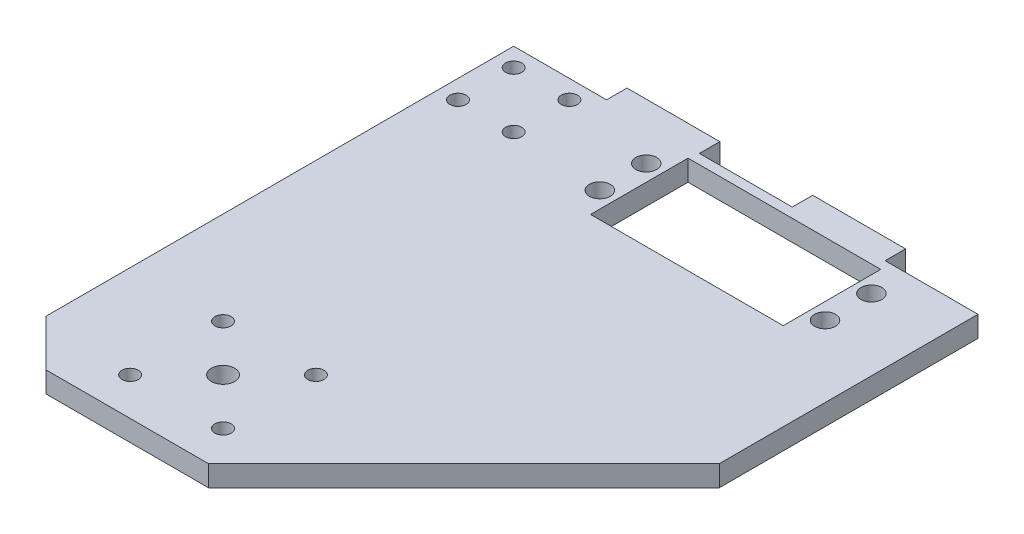
from build123d import *

# Parameters (mm, degrees)
SKETCH2_W           = 220
SKETCH2_H           = 140
BOSS_EXTRUDE1_DEPTH = 4.5
SKETCH3_R           = 2.5
CUT_EXTRUDE1_DEPTH  = 131.461680198
SKETCH4_W           = 20
SKETCH4_H           = 4.4
TEETH_CUT_DEPTH     = 131.461680198
TRIM_CUT_DEPTH      = 131.461680198
SKETCH6_R           = 2.25
SKETCH6_R_2         = 1.75
SKETCH6_W           = 41.5
SKETCH6_H           = 21
CUT_EXTRUDE2_DEPTH  = 100.097174531
CHAMFER4_SIZE       = 10
CHAMFER5_SIZE       = 55


with BuildPart() as part:
    # Sketch2 → Boss-Extrude1 (new body)
    with BuildSketch(Plane(origin=(0, 0, 0), x_dir=(1, 0, 0), z_dir=(0, 1, 0))):
        Rectangle(SKETCH2_W, SKETCH2_H)
    extrude(amount=BOSS_EXTRUDE1_DEPTH)

    # Sketch3 → Cut-Extrude1 (cut, through all)
    with BuildSketch(Plane(origin=(0, 4.5, 0), x_dir=(1, 0, 0), z_dir=(0, 1, 0))):
        with Locations((0, -27)):
            Circle(SKETCH3_R)
        with Locations((40.6, 53)):
            Circle(SKETCH3_R)
    extrude(amount=-CUT_EXTRUDE1_DEPTH, mode=Mode.SUBTRACT)

    # Sketch4 → Teeth cut (cut, through all)
    with BuildSketch(Plane.XZ):
        with Locations((100, -67.8)):
            Rectangle(SKETCH4_W, SKETCH4_H)
        with Locations((60, -67.8)):
            Rectangle(SKETCH4_W, SKETCH4_H)
        with Locations((20, -67.8)):
            Rectangle(SKETCH4_W, SKETCH4_H)
        with Locations((-20, -67.8)):
            Rectangle(SKETCH4_W, SKETCH4_H)
        with Locations((-60, -67.8)):
            Rectangle(SKETCH4_W, SKETCH4_H)
        with Locations((-100, -67.8)):
            Rectangle(SKETCH4_W, SKETCH4_H)
    extrude(amount=-TEETH_CUT_DEPTH, mode=Mode.SUBTRACT)

    # Sketch5 → Trim cut (cut, through all)
    with BuildSketch(Plane.XZ):
        Polygon((110, -70.1), (70, -70.1), (70, 45.124241674), (-30, 45.124241674), (-30, -70.1), (-110, -70.1), (-110, 70), (-30, 70), (70, 70), (110, 70), align=None)
    extrude(amount=-TRIM_CUT_DEPTH, mode=Mode.SUBTRACT)

    # Sketch6 → Cut-Extrude2 (cut, through all)
    with BuildSketch(Plane(origin=(0, 4.5, 0), x_dir=(1, 0, 0), z_dir=(0, 1, 0))):
        with Locations((6.15, 58)):
            Circle(SKETCH6_R)
        with Locations((6.15, 48)):
            Circle(SKETCH6_R)
        with Locations((54.65, 48)):
            Circle(SKETCH6_R)
        with Locations((54.65, 58)):
            Circle(SKETCH6_R)
        with Locations((-14, 49.6)):
            Circle(SKETCH6_R_2)
        with Locations((10, -17)):
            Circle(SKETCH6_R_2)
        with Locations((10, -37)):
            Circle(SKETCH6_R_2)
        with Locations((-10, -37)):
            Circle(SKETCH6_R_2)
        with Locations((-10, -17)):
            Circle(SKETCH6_R_2)
        with Locations((-26, 49.6)):
            Circle(SKETCH6_R_2)
        with Locations((-26, 61.6)):
            Circle(SKETCH6_R_2)
        with Locations((-14, 61.6)):
            Circle(SKETCH6_R_2)
        with Locations((30.4, 53)):
            Rectangle(SKETCH6_W, SKETCH6_H)
    extrude(amount=-CUT_EXTRUDE2_DEPTH, mode=Mode.SUBTRACT)

    # Chamfer4
    chamfer4_edges = [part.edges().sort_by_distance(p)[0] for p in [
        (-30, 2.25, 45.124241674),
    ]]
    chamfer(chamfer4_edges, length=CHAMFER4_SIZE)

    # Chamfer5
    chamfer5_edges = [part.edges().sort_by_distance(p)[0] for p in [
        (70, 2.25, 45.124241674),
    ]]
    chamfer(chamfer5_edges, length=CHAMFER5_SIZE)


solid = part.part
